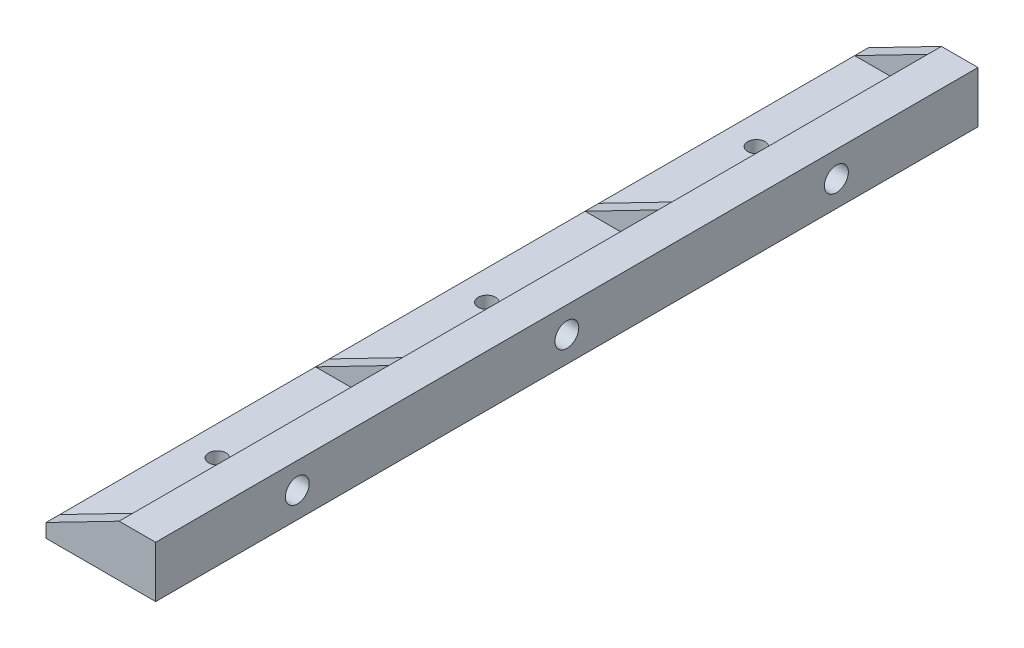
from build123d import *

# Parameters (mm, degrees)
BOSS_EXTRUDE1_DEPTH   = 180
RIB3_REACH            = 124.404
SKETCH4_WALL_W        = 264.810334732
SKETCH4_WALL_H        = 3
RIB4_START            = -3
RIB4_DEPTH            = 3
F_6_CLEARANCE_HOLE1_D = 3.7973
SKETCH6_R             = 2.3495
CUT_EXTRUDE1_DEPTH    = 7
SKETCH12_R            = 2.6162
CUT_EXTRUDE2_DEPTH    = 6.35


# Read off the part's stored shape, not the designer's step: Rib4
with BuildPart() as part:
    # Sketch1 → Boss-Extrude1 (new body)
    with BuildSketch(Plane.XY):
        with BuildLine():
            Line((0, 0), (0, 11.25))
            Line((0, 11.25), (-8, 11.25))
            Line((-8, 11.25), (-8, 6))
            ThreePointArc((-8, 6), (-8.878679656, 3.878679656), (-11, 3))
            Line((-11, 3), (-24, 3))
            Line((-24, 3), (-24, 0))
            Line((-24, 0), (0, 0))
        make_face()
    extrude(amount=BOSS_EXTRUDE1_DEPTH)

    # Sketch4 wall → Rib3 (add, up to next)
    with BuildSketch(Plane(origin=(-16, 7.125, 60.5), x_dir=(-0.888803167408, -0.458289133195, 0), z_dir=(-0.458289133195, 0.888803167408, 0)), mode=Mode.PRIVATE) as rib3_sk1:
        Rectangle(SKETCH4_WALL_W, SKETCH4_WALL_H)
    rib3_tool1 = extrude(rib3_sk1.sketch, amount=-RIB3_REACH, mode=Mode.PRIVATE) - part.part
    rib3 = rib3_tool1.solids().sort_by_distance((-16, 7.125, 60.5))[0]
    add(rib3)

    # Rib4 outline → Rib4 (add)
    with BuildSketch(Plane(origin=(0, 0, 0), x_dir=(-1, 0, 0), z_dir=(0, 0, -1)).offset(RIB4_START)):
        with BuildLine():
            Line((24, 3), (8, 11.25))
            Line((8, 11.25), (8, 6))
            ThreePointArc((8, 6), (8.878679656, 3.878679656), (11, 3))
            Line((11, 3), (24, 3))
        make_face()
    rib4 = extrude(amount=RIB4_DEPTH)

    # Mirror1: Rib3, Rib4 across plane
    add(rib3.mirror(Plane(origin=(0, 0, 90), x_dir=(1, 0, 0), z_dir=(0, 0, -1))))
    add(rib4.mirror(Plane(origin=(0, 0, 90), x_dir=(1, 0, 0), z_dir=(0, 0, -1))))

    # #6 Clearance Hole1 (through all)
    with Locations(Plane(origin=(0, 0, 0), x_dir=(-1, 0, 0), z_dir=(0, -1, 0))):
        with Locations((17.5, -31), (17.5, -149), (17.5, -90)):
            Hole(F_6_CLEARANCE_HOLE1_D / 2)

    # Sketch6 → Cut-Extrude1 (cut)
    with BuildSketch(Plane(origin=(0, 0, 0), x_dir=(0, 0, -1), z_dir=(1, 0, 0))):
        with Locations((-149, 5.625)):
            Circle(SKETCH6_R)
        with Locations((-31, 5.625)):
            Circle(SKETCH6_R)
        with Locations((-90, 5.625)):
            Circle(SKETCH6_R)
    extrude(amount=-CUT_EXTRUDE1_DEPTH, mode=Mode.SUBTRACT)

    # Sketch12 → Cut-Extrude2 (cut)
    with BuildSketch(Plane(origin=(0, 0, 0), x_dir=(0, 0, -1), z_dir=(1, 0, 0))):
        with Locations((-149, 5.625)):
            Circle(SKETCH12_R)
        with Locations((-31, 5.625)):
            Circle(SKETCH12_R)
        with Locations((-90, 5.625)):
            Circle(SKETCH12_R)
    extrude(amount=-CUT_EXTRUDE2_DEPTH, mode=Mode.SUBTRACT)


solid = part.part
